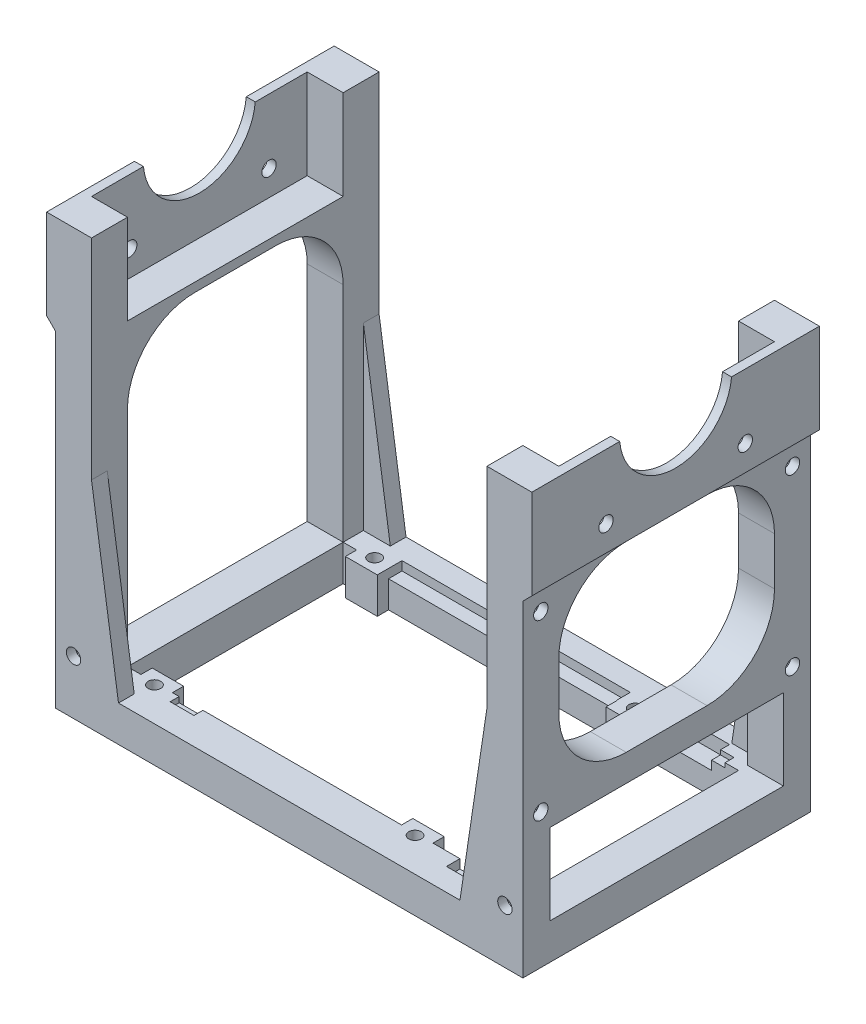
from build123d import *

# Parameters (mm, degrees)
SZKIC1_W                     = 8
SZKIC1_H                     = 48
SZKIC1_H_2                   = 8
SZKIC1_W_2                   = 92
DODANIE_WYCI_GNI_CIE1_DEPTH  = 8
SZKIC2_W                     = 8
SZKIC2_H                     = 8
DODANIE_WYCI_GNI_CIE3_DEPTH  = 64
SZKIC5_W                     = 2
SZKIC5_H                     = 18
WYTNIJ_WYCI_GNI_CIE2_DEPTH   = 8
SZKIC6_W                     = 8
SZKIC6_H                     = 6
DODANIE_WYCI_GNI_CIE5_DEPTH  = 48
SZKIC7_W                     = 50.8
SZKIC7_H                     = 3
WYTNIJ_WYCI_GNI_CIE3_DEPTH   = 2
DODANIE_WYCI_GNI_CIE7_DEPTH  = 8
DODANIE_WYCI_GNI_CIE8_DEPTH  = 8
DODANIE_WYCI_GNI_CIE9_DEPTH  = 8
DODANIE_WYCI_GNI_CIE10_DEPTH = 8
SZKIC17_W                    = 5.2
SZKIC17_H                    = 5.2
WYTNIJ_WYCI_GNI_CIE8_DEPTH   = 4
SZKIC18_R                    = 1.4
WYTNIJ_WYCI_GNI_CIE9_DEPTH   = 4.5
SZKIC19_W                    = 5.2
SZKIC19_H                    = 5.2
SZKIC19_R                    = 1.4
DODANIE_WYCI_GNI_CIE11_DEPTH = 2.3
SZKIC21_W                    = 48
SZKIC21_H                    = 8
SZKIC21_W_2                  = 8
SZKIC21_H_2                  = 64
DODANIE_WYCI_GNI_CIE12_DEPTH = 4
SZKIC22_W                    = 4
SZKIC22_H                    = 64
WYTNIJ_WYCI_GNI_CIE11_DEPTH  = 84
SZKIC24_W                    = 8
SZKIC24_H                    = 8
DODANIE_WYCI_GNI_CIE13_DEPTH = 2.64
SZKIC25_W                    = 8
SZKIC25_H                    = 2
DODANIE_WYCI_GNI_CIE14_DEPTH = 48
SZKIC26_W                    = 8
SZKIC26_H                    = 8
DODANIE_WYCI_GNI_CIE15_DEPTH = 20
SZKIC27_R                    = 1.6
DODANIE_WYCI_GNI_CIE16_DEPTH = 2
DODANIE_WYCI_GNI_CIE17_START = 2
SZKIC28_R                    = 1.6
DODANIE_WYCI_GNI_CIE17_DEPTH = 2
SFAZOWANIE1_SIZE             = 2
SZKIC29_W                    = 5.65685425
SZKIC29_H                    = 5.65685425
WYTNIJ_WYCI_GNI_CIE12_DEPTH  = 4
SZKIC29_4_R                  = 1.6
WYTNIJ_WYCI_GNI_CIE13_DEPTH  = 4.2
SZKIC29_7_R                  = 1.6
SZKIC29_7_W                  = 5.65685425
SZKIC29_7_H                  = 5.65685425
DODANIE_WYCI_GNI_CIE18_DEPTH = 2
SZKIC30_W                    = 5.65685425
SZKIC30_H                    = 5.65685425
WYTNIJ_WYCI_GNI_CIE14_DEPTH  = 4
WYTNIJ_WYCI_GNI_CIE15_START  = -4.2
SZKIC30_6_R                  = 1.6
WYTNIJ_WYCI_GNI_CIE15_DEPTH  = 4.2
DODANIE_WYCI_GNI_CIE20_START = -2
SZKIC30_8_W                  = 5.65685425
SZKIC30_8_H                  = 5.65685425
SZKIC30_8_R                  = 1.6
DODANIE_WYCI_GNI_CIE20_DEPTH = 2
SZKIC31_W                    = 5.65685425
SZKIC31_H                    = 5.65685425
SZKIC31_R                    = 1.6
WYTNIJ_WYCI_GNI_CIE16_DEPTH  = 4
SZKIC31_2_R                  = 1.6
WYTNIJ_WYCI_GNI_CIE17_DEPTH  = 4.2
SZKIC31_3_W                  = 5.65685425
SZKIC31_3_H                  = 5.65685425
SZKIC31_3_R                  = 1.6
DODANIE_WYCI_GNI_CIE21_DEPTH = 2
WYTNIJ_WYCI_GNI_CIE18_START  = -4
SZKIC32_W                    = 5.65685425
SZKIC32_H                    = 5.65685425
SZKIC32_R                    = 1.6
WYTNIJ_WYCI_GNI_CIE18_DEPTH  = 4
WYTNIJ_WYCI_GNI_CIE19_START  = -4.2
SZKIC32_2_R                  = 1.6
WYTNIJ_WYCI_GNI_CIE19_DEPTH  = 4.2
DODANIE_WYCI_GNI_CIE22_START = -2
SZKIC32_3_W                  = 5.65685425
SZKIC32_3_H                  = 5.65685425
SZKIC32_3_R                  = 1.6
DODANIE_WYCI_GNI_CIE22_DEPTH = 2
SZKIC33_W                    = 5.65685425
SZKIC33_H                    = 5.65685425
SZKIC33_R                    = 1.6
WYTNIJ_WYCI_GNI_CIE20_DEPTH  = 4
SZKIC33_2_R                  = 1.6
WYTNIJ_WYCI_GNI_CIE21_DEPTH  = 4.2
SZKIC33_3_W                  = 5.65685425
SZKIC33_3_H                  = 5.65685425
SZKIC33_3_R                  = 1.6
DODANIE_WYCI_GNI_CIE23_DEPTH = 2
DODANIE_WYCI_GNI_CIE24_DEPTH = 3.5
DODANIE_WYCI_GNI_CIE25_DEPTH = 3.5
ZAOKR_GLENIE1_R              = 15
SFAZOWANIE2_SIZE             = 4
SFAZOWANIE2_SIZE2            = 1
SZKIC38_W                    = 5.3
SZKIC38_H                    = 1.2
WYTNIJ_WYCI_GNI_CIE22_DEPTH  = 2
SZKIC39_W                    = 5
SZKIC39_H                    = 2
WYTNIJ_WYCI_GNI_CIE23_DEPTH  = 3
SZKIC40_W                    = 9
SZKIC40_H                    = 3
WYTNIJ_WYCI_GNI_CIE24_DEPTH  = 4
SZKIC41_W                    = 3
SZKIC41_H                    = 1
WYTNIJ_WYCI_GNI_CIE25_DEPTH  = 2
SZKIC42_W                    = 8
SZKIC42_H                    = 2
WYTNIJ_WYCI_GNI_CIE26_DEPTH  = 3


with BuildPart() as part:
    # Szkic1 → Dodanie-wyciągnięcie1 (new body)
    with BuildSketch(Plane(origin=(0, 0, 0), x_dir=(1, 0, 0), z_dir=(0, 1, 0))):
        with Locations((4, 32)):
            Rectangle(SZKIC1_W, SZKIC1_H)
        with Locations((4, 4)):
            Rectangle(SZKIC1_W, SZKIC1_H_2)
        with Locations((4, 60)):
            Rectangle(SZKIC1_W, SZKIC1_H_2)
        with Locations((54, 60)):
            Rectangle(SZKIC1_W_2, SZKIC1_H_2)
        with Locations((104, 60)):
            Rectangle(SZKIC1_W, SZKIC1_H_2)
        with Locations((104, 32)):
            Rectangle(SZKIC1_W, SZKIC1_H)
        with Locations((104, 4)):
            Rectangle(SZKIC1_W, SZKIC1_H_2)
        with Locations((54, 4)):
            Rectangle(SZKIC1_W_2, SZKIC1_H_2)
    extrude(amount=DODANIE_WYCI_GNI_CIE1_DEPTH)

    # Szkic2 → Dodanie-wyciągnięcie3 (add)
    with BuildSketch(Plane(origin=(0, 8, 0), x_dir=(1, 0, 0), z_dir=(0, 1, 0))):
        with Locations((4, 60)):
            Rectangle(SZKIC2_W, SZKIC2_H)
        with Locations((4, 4)):
            Rectangle(SZKIC2_W, SZKIC2_H)
        with Locations((104, 4)):
            Rectangle(SZKIC2_W, SZKIC2_H)
        with Locations((104, 60)):
            Rectangle(SZKIC2_W, SZKIC2_H)
    extrude(amount=DODANIE_WYCI_GNI_CIE3_DEPTH)

    # Szkic5 → Wytnij-wyciągnięcie2 (cut)
    with BuildSketch(Plane(origin=(108, 0, 0), x_dir=(0, 0, -1), z_dir=(1, 0, 0))):
        with Locations((7, 17)):
            Rectangle(SZKIC5_W, SZKIC5_H)
        with Locations((57, 17)):
            Rectangle(SZKIC5_W, SZKIC5_H)
    extrude(amount=-WYTNIJ_WYCI_GNI_CIE2_DEPTH, mode=Mode.SUBTRACT)

    # Szkic6 → Dodanie-wyciągnięcie5 (add)
    with BuildSketch(Plane(origin=(0, 0, -8), x_dir=(-1, 0, 0), z_dir=(0, 0, -1))):
        with Locations((-104, 29)):
            Rectangle(SZKIC6_W, SZKIC6_H)
    extrude(amount=DODANIE_WYCI_GNI_CIE5_DEPTH)

    # Szkic7 → Wytnij-wyciągnięcie3 (cut)
    with BuildSketch(Plane(origin=(0, 8, 0), x_dir=(1, 0, 0), z_dir=(0, 1, 0))):
        with Locations((47.5, 57.5)):
            Rectangle(SZKIC7_W, SZKIC7_H)
    extrude(amount=-WYTNIJ_WYCI_GNI_CIE3_DEPTH, mode=Mode.SUBTRACT)

    # Szkic12 → Dodanie-wyciągnięcie7 (add)
    with BuildSketch(Plane(origin=(0, 8, 0), x_dir=(1, 0, 0), z_dir=(0, 1, 0))):
        with BuildLine():
            Line((22.1, 56), (20.177050983, 56))
            ThreePointArc((20.177050983, 56), (18.5, 54.75), (16.822949017, 56))
            Line((16.822949017, 56), (15, 56))
            Line((15, 56), (15, 53.5))
            Line((15, 53.5), (18.5, 53.5))
            Line((18.5, 53.5), (22.1, 53.5))
            Line((22.1, 53.5), (22.1, 56))
        make_face()
        with BuildLine():
            ThreePointArc((16.822949017, 56), (18.5, 54.75), (20.177050983, 56))
            Line((20.177050983, 56), (16.822949017, 56))
        make_face()
    extrude(amount=-DODANIE_WYCI_GNI_CIE7_DEPTH)

    # Szkic14 → Dodanie-wyciągnięcie8 (add)
    with BuildSketch(Plane(origin=(0, 8, 0), x_dir=(1, 0, 0), z_dir=(0, 1, 0))):
        Polygon((18.5, 7.5), (15, 7.5), (15, 10.5), (18.5, 10.5), (22, 10.5), (22, 7.5), align=None)
    extrude(amount=-DODANIE_WYCI_GNI_CIE8_DEPTH)

    # Szkic15 → Dodanie-wyciągnięcie9 (add)
    with BuildSketch(Plane(origin=(0, 8, 0), x_dir=(1, 0, 0), z_dir=(0, 1, 0))):
        Polygon((76.5, 53.5), (73, 53.5), (73, 56.5), (76.5, 56.5), (80, 56.5), (80, 53.5), align=None)
    extrude(amount=-DODANIE_WYCI_GNI_CIE9_DEPTH)

    # Szkic16 → Dodanie-wyciągnięcie10 (add)
    with BuildSketch(Plane(origin=(0, 8, 0), x_dir=(1, 0, 0), z_dir=(0, 1, 0))):
        Polygon((76.5, 7.5), (80, 7.5), (80, 10.5), (76.5, 10.5), (73, 10.5), (73, 7.5), align=None)
    extrude(amount=-DODANIE_WYCI_GNI_CIE10_DEPTH)

    # Szkic17 → Wytnij-wyciągnięcie8 (cut)
    with BuildSketch(Plane(origin=(0, 8, 0), x_dir=(1, 0, 0), z_dir=(0, 1, 0))):
        with Locations((76.5, 7.5)):
            Rectangle(SZKIC17_W, SZKIC17_H)
        with Locations((18.5, 56.5)):
            Rectangle(SZKIC17_W, SZKIC17_H)
        with Locations((18.5, 7.5)):
            Rectangle(SZKIC17_W, SZKIC17_H)
        with Locations((76.5, 56.5)):
            Rectangle(SZKIC17_W, SZKIC17_H)
    extrude(amount=-WYTNIJ_WYCI_GNI_CIE8_DEPTH, mode=Mode.SUBTRACT)

    # Szkic18 → Wytnij-wyciągnięcie9 (cut)
    with BuildSketch(Plane(origin=(0, 8, 0), x_dir=(1, 0, 0), z_dir=(0, 1, 0))):
        with Locations(Location((18.5, 56.5, 0), (0, 0, 270))):
            Circle(SZKIC18_R)
        with Locations(Location((18.5, 7.5, 0), (0, 0, 270))):
            Circle(SZKIC18_R)
        with Locations(Location((76.5, 7.5, 0), (0, 0, 270))):
            Circle(SZKIC18_R)
        with Locations(Location((76.5, 56.5, 0), (0, 0, 270))):
            Circle(SZKIC18_R)
    extrude(amount=-WYTNIJ_WYCI_GNI_CIE9_DEPTH, mode=Mode.SUBTRACT)

    # Szkic19 → Dodanie-wyciągnięcie11 (add)
    # profile 1 of 4: a face of its own
    with BuildSketch(Plane(origin=(0, 8, 0), x_dir=(1, 0, 0), z_dir=(0, 1, 0))):
        with Locations((18.5, 56.5)):
            Rectangle(SZKIC19_W, SZKIC19_H)
        with Locations(Location((18.5, 56.5, 0), (0, 0, 270))):
            Circle(SZKIC19_R, mode=Mode.SUBTRACT)
    # profile 2 of 4: a face of its own
    with BuildSketch(Plane(origin=(0, 8, 0), x_dir=(1, 0, 0), z_dir=(0, 1, 0))):
        with Locations((18.5, 7.5)):
            Rectangle(SZKIC19_W, SZKIC19_H)
        with Locations(Location((18.5, 7.5, 0), (0, 0, 270))):
            Circle(SZKIC19_R, mode=Mode.SUBTRACT)
    # profile 3 of 4: a face of its own
    with BuildSketch(Plane(origin=(0, 8, 0), x_dir=(1, 0, 0), z_dir=(0, 1, 0))):
        with Locations((76.5, 7.5)):
            Rectangle(SZKIC19_W, SZKIC19_H)
        with Locations(Location((76.5, 7.5, 0), (0, 0, 270))):
            Circle(SZKIC19_R, mode=Mode.SUBTRACT)
    # profile 4 of 4: a face of its own
    with BuildSketch(Plane(origin=(0, 8, 0), x_dir=(1, 0, 0), z_dir=(0, 1, 0))):
        with Locations((76.5, 56.5)):
            Rectangle(SZKIC19_W, SZKIC19_H)
        with Locations(Location((76.5, 56.5, 0), (0, 0, 270))):
            Circle(SZKIC19_R, mode=Mode.SUBTRACT)
    extrude(amount=-DODANIE_WYCI_GNI_CIE11_DEPTH)

    # Szkic21 → Dodanie-wyciągnięcie12 (add)
    with BuildSketch(Plane(origin=(8, 0, 0), x_dir=(0, 0, -1), z_dir=(1, 0, 0))):
        with Locations((32, 4)):
            Rectangle(SZKIC21_W, SZKIC21_H)
        with Locations((4, 40)):
            Rectangle(SZKIC21_W_2, SZKIC21_H_2)
        with Locations((60, 40)):
            Rectangle(SZKIC21_W_2, SZKIC21_H_2)
    extrude(amount=DODANIE_WYCI_GNI_CIE12_DEPTH)

    # Szkic22 → Wytnij-wyciągnięcie11 (cut)
    with BuildSketch(Plane.XZ):
        with Locations((2, -32)):
            Rectangle(SZKIC22_W, SZKIC22_H)
    extrude(amount=-WYTNIJ_WYCI_GNI_CIE11_DEPTH, mode=Mode.SUBTRACT)

    # Szkic24 → Dodanie-wyciągnięcie13 (add)
    with BuildSketch(Plane(origin=(0, 72, 0), x_dir=(1, 0, 0), z_dir=(0, 1, 0))):
        with Locations((8, 4)):
            Rectangle(SZKIC24_W, SZKIC24_H)
        with Locations((104, 4)):
            Rectangle(SZKIC24_W, SZKIC24_H)
        with Locations((104, 60)):
            Rectangle(SZKIC24_W, SZKIC24_H)
        with Locations((8, 60)):
            Rectangle(SZKIC24_W, SZKIC24_H)
    extrude(amount=DODANIE_WYCI_GNI_CIE13_DEPTH)

    # Szkic25 → Dodanie-wyciągnięcie14 (add)
    with BuildSketch(Plane(origin=(0, 0, -8), x_dir=(-1, 0, 0), z_dir=(0, 0, -1))):
        with Locations((-104, 73.64)):
            Rectangle(SZKIC25_W, SZKIC25_H)
        with Locations((-8, 73.64)):
            Rectangle(SZKIC25_W, SZKIC25_H)
    extrude(amount=DODANIE_WYCI_GNI_CIE14_DEPTH)

    # Szkic26 → Dodanie-wyciągnięcie15 (add)
    with BuildSketch(Plane(origin=(0, 74.64, 0), x_dir=(1, 0, 0), z_dir=(0, 1, 0))):
        with Locations((8, 60)):
            Rectangle(SZKIC26_W, SZKIC26_H)
        with Locations((8, 4)):
            Rectangle(SZKIC26_W, SZKIC26_H)
        with Locations((104, 4)):
            Rectangle(SZKIC26_W, SZKIC26_H)
        with Locations((104, 60)):
            Rectangle(SZKIC26_W, SZKIC26_H)
    extrude(amount=DODANIE_WYCI_GNI_CIE15_DEPTH)

    # Szkic27 → Dodanie-wyciągnięcie16 (add)
    with BuildSketch(Plane.ZY.offset(-4)):
        with BuildLine():
            Line((-64, 94.64), (-64, 72.64))
            Line((-64, 72.64), (0, 72.64))
            Line((0, 72.64), (0, 94.64))
            Line((0, 94.64), (-19.553012413, 94.64))
            ThreePointArc((-19.553012413, 94.64), (-32, 83.29), (-44.446987587, 94.64))
            Line((-44.446987587, 94.64), (-64, 94.64))
        make_face()
        with Locations((-47.5, 80.29)):
            Circle(SZKIC27_R, mode=Mode.SUBTRACT)
        with Locations((-16.5, 80.29)):
            Circle(SZKIC27_R, mode=Mode.SUBTRACT)
    extrude(amount=DODANIE_WYCI_GNI_CIE16_DEPTH)

    # Szkic28 → Dodanie-wyciągnięcie17 (add)
    with BuildSketch(Plane(origin=(108, 0, 0), x_dir=(0, 0, -1), z_dir=(1, 0, 0)).offset(DODANIE_WYCI_GNI_CIE17_START)):
        with BuildLine():
            Line((64, 72.64), (64, 94.64))
            Line((64, 94.64), (44.446987587, 94.64))
            ThreePointArc((44.446987587, 94.64), (32, 83.29), (19.553012413, 94.64))
            Line((19.553012413, 94.64), (0, 94.64))
            Line((0, 94.64), (0, 72.64))
            Line((0, 72.64), (64, 72.64))
        make_face()
        with Locations(Location((16.5, 80.29, 0), (0, 0, 180))):
            Circle(SZKIC28_R, mode=Mode.SUBTRACT)
        with Locations(Location((47.5, 80.29, 0), (0, 0, 180))):
            Circle(SZKIC28_R, mode=Mode.SUBTRACT)
    extrude(amount=-DODANIE_WYCI_GNI_CIE17_DEPTH)

    # Sfazowanie1
    sfazowanie1_edges = [part.edges().sort_by_distance(p)[0] for p in [
        (2, 72.64, -32),
        (110, 72.64, -32),
    ]]
    chamfer(sfazowanie1_edges, length=SFAZOWANIE1_SIZE)

    # Szkic29 → Wytnij-wyciągnięcie12 (cut)
    with BuildSketch(Plane.XY):
        Polygon((5.189195685, 14.895942864), (5.154059189, 9.239197738), (10.810804315, 9.204061241), (10.845940811, 14.860806368), align=None)
        with Locations((104, 12)):
            Rectangle(SZKIC29_W, SZKIC29_H)
    extrude(amount=-WYTNIJ_WYCI_GNI_CIE12_DEPTH, mode=Mode.SUBTRACT)

    # Szkic29<4> → Wytnij-wyciągnięcie13 (cut)
    with BuildSketch(Plane.XY):
        with Locations((8, 12.050002053)):
            Circle(SZKIC29_4_R)
        with Locations((104, 12)):
            Circle(SZKIC29_4_R)
    extrude(amount=-WYTNIJ_WYCI_GNI_CIE13_DEPTH, mode=Mode.SUBTRACT)

    # Szkic29<7> → Dodanie-wyciągnięcie18 (add)
    # profile 1 of 2: a face of its own
    with BuildSketch(Plane.XY):
        Polygon((5.189195685, 14.895942864), (5.154059189, 9.239197738), (10.810804315, 9.204061241), (10.845940811, 14.860806368), align=None)
        with Locations((8, 12.050002053)):
            Circle(SZKIC29_7_R, mode=Mode.SUBTRACT)
    # profile 2 of 2: a face of its own
    with BuildSketch(Plane.XY):
        with Locations((104, 12)):
            Rectangle(SZKIC29_7_W, SZKIC29_7_H)
        with Locations((104, 12)):
            Circle(SZKIC29_7_R, mode=Mode.SUBTRACT)
    extrude(amount=-DODANIE_WYCI_GNI_CIE18_DEPTH)

    # Szkic30 → Wytnij-wyciągnięcie14 (cut)
    with BuildSketch(Plane(origin=(0, 0, -64), x_dir=(-1, 0, 0), z_dir=(0, 0, -1))):
        with Locations((-8, 12)):
            Rectangle(SZKIC30_W, SZKIC30_H)
        with Locations((-104, 12)):
            Rectangle(SZKIC30_W, SZKIC30_H)
    extrude(amount=-WYTNIJ_WYCI_GNI_CIE14_DEPTH, mode=Mode.SUBTRACT)

    # Szkic30<6> → Wytnij-wyciągnięcie15 (cut)
    with BuildSketch(Plane(origin=(0, 0, -64), x_dir=(-1, 0, 0), z_dir=(0, 0, -1)).offset(WYTNIJ_WYCI_GNI_CIE15_START)):
        with Locations(Location((-104, 12, 0), (0, 0, 180))):
            Circle(SZKIC30_6_R)
        with Locations((-8, 12)):
            Circle(SZKIC30_6_R)
    extrude(amount=WYTNIJ_WYCI_GNI_CIE15_DEPTH, mode=Mode.SUBTRACT)

    # Szkic30<8> → Dodanie-wyciągnięcie20 (add)
    # profile 1 of 2: a face of its own
    with BuildSketch(Plane(origin=(0, 0, -64), x_dir=(-1, 0, 0), z_dir=(0, 0, -1)).offset(DODANIE_WYCI_GNI_CIE20_START)):
        with Locations((-8, 12)):
            Rectangle(SZKIC30_8_W, SZKIC30_8_H)
        with Locations((-8, 12)):
            Circle(SZKIC30_8_R, mode=Mode.SUBTRACT)
    # profile 2 of 2: a face of its own
    with BuildSketch(Plane(origin=(0, 0, -64), x_dir=(-1, 0, 0), z_dir=(0, 0, -1)).offset(DODANIE_WYCI_GNI_CIE20_START)):
        with Locations((-104, 12)):
            Rectangle(SZKIC30_8_W, SZKIC30_8_H)
        with Locations(Location((-104, 12, 0), (0, 0, 180))):
            Circle(SZKIC30_8_R, mode=Mode.SUBTRACT)
    extrude(amount=DODANIE_WYCI_GNI_CIE20_DEPTH)

    # Szkic31 → Wytnij-wyciągnięcie16 (cut)
    # profile 1 of 4: a face of its own
    with BuildSketch(Plane.ZY.offset(-4)):
        with Locations((-60, 20)):
            Rectangle(SZKIC31_W, SZKIC31_H)
        with Locations((-60, 20)):
            Circle(SZKIC31_R, mode=Mode.SUBTRACT)
    # profile 2 of 4: a face of its own
    with BuildSketch(Plane.ZY.offset(-4)):
        with Locations((-4, 20)):
            Rectangle(SZKIC31_W, SZKIC31_H)
        with Locations((-4, 20)):
            Circle(SZKIC31_R, mode=Mode.SUBTRACT)
    # profile 3 of 4: a face of its own
    with BuildSketch(Plane.ZY.offset(-4)):
        with Locations((-4, 68.64)):
            Rectangle(SZKIC31_W, SZKIC31_H)
        with Locations((-4, 68.64)):
            Circle(SZKIC31_R, mode=Mode.SUBTRACT)
    # profile 4 of 4: a face of its own
    with BuildSketch(Plane.ZY.offset(-4)):
        with Locations((-60, 68.64)):
            Rectangle(SZKIC31_W, SZKIC31_H)
        with Locations((-60, 68.64)):
            Circle(SZKIC31_R, mode=Mode.SUBTRACT)
    extrude(amount=-WYTNIJ_WYCI_GNI_CIE16_DEPTH, mode=Mode.SUBTRACT)

    # Szkic31<2> → Wytnij-wyciągnięcie17 (cut)
    with BuildSketch(Plane.ZY.offset(-4)):
        with Locations((-60, 20)):
            Circle(SZKIC31_2_R)
        with Locations((-4, 20)):
            Circle(SZKIC31_2_R)
        with Locations((-4, 68.64)):
            Circle(SZKIC31_2_R)
        with Locations((-60, 68.64)):
            Circle(SZKIC31_2_R)
    extrude(amount=-WYTNIJ_WYCI_GNI_CIE17_DEPTH, mode=Mode.SUBTRACT)

    # Szkic31<3> → Dodanie-wyciągnięcie21 (add)
    # profile 1 of 4: a face of its own
    with BuildSketch(Plane.ZY.offset(-4)):
        with Locations((-60, 20)):
            Rectangle(SZKIC31_3_W, SZKIC31_3_H)
        with Locations((-60, 20)):
            Circle(SZKIC31_3_R, mode=Mode.SUBTRACT)
    # profile 2 of 4: a face of its own
    with BuildSketch(Plane.ZY.offset(-4)):
        with Locations((-4, 20)):
            Rectangle(SZKIC31_3_W, SZKIC31_3_H)
        with Locations((-4, 20)):
            Circle(SZKIC31_3_R, mode=Mode.SUBTRACT)
    # profile 3 of 4: a face of its own
    with BuildSketch(Plane.ZY.offset(-4)):
        with Locations((-4, 68.64)):
            Rectangle(SZKIC31_3_W, SZKIC31_3_H)
        with Locations((-4, 68.64)):
            Circle(SZKIC31_3_R, mode=Mode.SUBTRACT)
    # profile 4 of 4: a face of its own
    with BuildSketch(Plane.ZY.offset(-4)):
        with Locations((-60, 68.64)):
            Rectangle(SZKIC31_3_W, SZKIC31_3_H)
        with Locations((-60, 68.64)):
            Circle(SZKIC31_3_R, mode=Mode.SUBTRACT)
    extrude(amount=-DODANIE_WYCI_GNI_CIE21_DEPTH)

    # Szkic32 → Wytnij-wyciągnięcie18 (cut)
    # profile 1 of 4: a face of its own
    with BuildSketch(Plane(origin=(108, 0, 0), x_dir=(0, 0, -1), z_dir=(1, 0, 0)).offset(WYTNIJ_WYCI_GNI_CIE18_START)):
        with Locations((60, 68.64)):
            Rectangle(SZKIC32_W, SZKIC32_H)
        with Locations(Location((60, 68.64, 0), (0, 0, 180))):
            Circle(SZKIC32_R, mode=Mode.SUBTRACT)
    # profile 2 of 4: a face of its own
    with BuildSketch(Plane(origin=(108, 0, 0), x_dir=(0, 0, -1), z_dir=(1, 0, 0)).offset(WYTNIJ_WYCI_GNI_CIE18_START)):
        with Locations((4, 68.64)):
            Rectangle(SZKIC32_W, SZKIC32_H)
        with Locations(Location((4, 68.64, 0), (0, 0, 180))):
            Circle(SZKIC32_R, mode=Mode.SUBTRACT)
    # profile 3 of 4: a face of its own
    with BuildSketch(Plane(origin=(108, 0, 0), x_dir=(0, 0, -1), z_dir=(1, 0, 0)).offset(WYTNIJ_WYCI_GNI_CIE18_START)):
        with Locations((60, 30)):
            Rectangle(SZKIC32_W, SZKIC32_H)
        with Locations((60, 30)):
            Circle(SZKIC32_R, mode=Mode.SUBTRACT)
    # profile 4 of 4: a face of its own
    with BuildSketch(Plane(origin=(108, 0, 0), x_dir=(0, 0, -1), z_dir=(1, 0, 0)).offset(WYTNIJ_WYCI_GNI_CIE18_START)):
        with Locations((4, 30)):
            Rectangle(SZKIC32_W, SZKIC32_H)
        with Locations((4, 30)):
            Circle(SZKIC32_R, mode=Mode.SUBTRACT)
    extrude(amount=WYTNIJ_WYCI_GNI_CIE18_DEPTH, mode=Mode.SUBTRACT)

    # Szkic32<2> → Wytnij-wyciągnięcie19 (cut)
    with BuildSketch(Plane(origin=(108, 0, 0), x_dir=(0, 0, -1), z_dir=(1, 0, 0)).offset(WYTNIJ_WYCI_GNI_CIE19_START)):
        with Locations(Location((4, 68.64, 0), (0, 0, 180))):
            Circle(SZKIC32_2_R)
        with Locations(Location((60, 68.64, 0), (0, 0, 180))):
            Circle(SZKIC32_2_R)
        with Locations((60, 30)):
            Circle(SZKIC32_2_R)
        with Locations((4, 30)):
            Circle(SZKIC32_2_R)
    extrude(amount=WYTNIJ_WYCI_GNI_CIE19_DEPTH, mode=Mode.SUBTRACT)

    # Szkic32<3> → Dodanie-wyciągnięcie22 (add)
    # profile 1 of 4: a face of its own
    with BuildSketch(Plane(origin=(108, 0, 0), x_dir=(0, 0, -1), z_dir=(1, 0, 0)).offset(DODANIE_WYCI_GNI_CIE22_START)):
        with Locations((60, 68.64)):
            Rectangle(SZKIC32_3_W, SZKIC32_3_H)
        with Locations(Location((60, 68.64, 0), (0, 0, 180))):
            Circle(SZKIC32_3_R, mode=Mode.SUBTRACT)
    # profile 2 of 4: a face of its own
    with BuildSketch(Plane(origin=(108, 0, 0), x_dir=(0, 0, -1), z_dir=(1, 0, 0)).offset(DODANIE_WYCI_GNI_CIE22_START)):
        with Locations((4, 68.64)):
            Rectangle(SZKIC32_3_W, SZKIC32_3_H)
        with Locations(Location((4, 68.64, 0), (0, 0, 180))):
            Circle(SZKIC32_3_R, mode=Mode.SUBTRACT)
    # profile 3 of 4: a face of its own
    with BuildSketch(Plane(origin=(108, 0, 0), x_dir=(0, 0, -1), z_dir=(1, 0, 0)).offset(DODANIE_WYCI_GNI_CIE22_START)):
        with Locations((60, 30)):
            Rectangle(SZKIC32_3_W, SZKIC32_3_H)
        with Locations((60, 30)):
            Circle(SZKIC32_3_R, mode=Mode.SUBTRACT)
    # profile 4 of 4: a face of its own
    with BuildSketch(Plane(origin=(108, 0, 0), x_dir=(0, 0, -1), z_dir=(1, 0, 0)).offset(DODANIE_WYCI_GNI_CIE22_START)):
        with Locations((4, 30)):
            Rectangle(SZKIC32_3_W, SZKIC32_3_H)
        with Locations((4, 30)):
            Circle(SZKIC32_3_R, mode=Mode.SUBTRACT)
    extrude(amount=DODANIE_WYCI_GNI_CIE22_DEPTH)

    # Szkic33 → Wytnij-wyciągnięcie20 (cut)
    # profile 1 of 4: a face of its own
    with BuildSketch(Plane.XZ):
        with Locations((8, -60)):
            Rectangle(SZKIC33_W, SZKIC33_H)
        with Locations(Location((8, -60, 0), (0, 0, 270))):
            Circle(SZKIC33_R, mode=Mode.SUBTRACT)
    # profile 2 of 4: a face of its own
    with BuildSketch(Plane.XZ):
        with Locations((104, -60)):
            Rectangle(SZKIC33_W, SZKIC33_H)
        with Locations(Location((104, -60, 0), (0, 0, 270))):
            Circle(SZKIC33_R, mode=Mode.SUBTRACT)
    # profile 3 of 4: a face of its own
    with BuildSketch(Plane.XZ):
        with Locations((104, -4)):
            Rectangle(SZKIC33_W, SZKIC33_H)
        with Locations(Location((104, -4, 0), (0, 0, 270))):
            Circle(SZKIC33_R, mode=Mode.SUBTRACT)
    # profile 4 of 4: a face of its own
    with BuildSketch(Plane.XZ):
        with Locations((8, -4)):
            Rectangle(SZKIC33_W, SZKIC33_H)
        with Locations(Location((8, -4, 0), (0, 0, 270))):
            Circle(SZKIC33_R, mode=Mode.SUBTRACT)
    extrude(amount=-WYTNIJ_WYCI_GNI_CIE20_DEPTH, mode=Mode.SUBTRACT)

    # Szkic33<2> → Wytnij-wyciągnięcie21 (cut)
    with BuildSketch(Plane.XZ):
        with Locations(Location((8, -4, 0), (0, 0, 270))):
            Circle(SZKIC33_2_R)
        with Locations(Location((104, -4, 0), (0, 0, 270))):
            Circle(SZKIC33_2_R)
        with Locations(Location((104, -60, 0), (0, 0, 270))):
            Circle(SZKIC33_2_R)
        with Locations(Location((8, -60, 0), (0, 0, 270))):
            Circle(SZKIC33_2_R)
    extrude(amount=-WYTNIJ_WYCI_GNI_CIE21_DEPTH, mode=Mode.SUBTRACT)

    # Szkic33<3> → Dodanie-wyciągnięcie23 (add)
    # profile 1 of 4: a face of its own
    with BuildSketch(Plane.XZ):
        with Locations((8, -60)):
            Rectangle(SZKIC33_3_W, SZKIC33_3_H)
        with Locations(Location((8, -60, 0), (0, 0, 270))):
            Circle(SZKIC33_3_R, mode=Mode.SUBTRACT)
    # profile 2 of 4: a face of its own
    with BuildSketch(Plane.XZ):
        with Locations((104, -60)):
            Rectangle(SZKIC33_3_W, SZKIC33_3_H)
        with Locations(Location((104, -60, 0), (0, 0, 270))):
            Circle(SZKIC33_3_R, mode=Mode.SUBTRACT)
    # profile 3 of 4: a face of its own
    with BuildSketch(Plane.XZ):
        with Locations((104, -4)):
            Rectangle(SZKIC33_3_W, SZKIC33_3_H)
        with Locations(Location((104, -4, 0), (0, 0, 270))):
            Circle(SZKIC33_3_R, mode=Mode.SUBTRACT)
    # profile 4 of 4: a face of its own
    with BuildSketch(Plane.XZ):
        with Locations((8, -4)):
            Rectangle(SZKIC33_3_W, SZKIC33_3_H)
        with Locations(Location((8, -4, 0), (0, 0, 270))):
            Circle(SZKIC33_3_R, mode=Mode.SUBTRACT)
    extrude(amount=-DODANIE_WYCI_GNI_CIE23_DEPTH)

    # Szkic36 → Dodanie-wyciągnięcie24 (add)
    with BuildSketch(Plane.XY):
        Polygon((12, 8), (18, 8), (12, 48), align=None)
        Polygon((100, 8), (94, 8), (100, 48), align=None)
    extrude(amount=-DODANIE_WYCI_GNI_CIE24_DEPTH)

    # Szkic37 → Dodanie-wyciągnięcie25 (add)
    with BuildSketch(Plane(origin=(0, 0, -64), x_dir=(-1, 0, 0), z_dir=(0, 0, -1))):
        Polygon((-12, 8), (-18, 8), (-12, 48), align=None)
        Polygon((-100, 8), (-94, 8), (-100, 48), align=None)
    extrude(amount=-DODANIE_WYCI_GNI_CIE25_DEPTH)

    # Zaokrąglenie1
    # the kernel refuses this fillet: 15 mm, written as the material it adds along each edge
    with BuildSketch(Plane(origin=(100, 32, -8), x_dir=(0, 1, 0), z_dir=(1, 0, 0)), Plane(origin=(100, 32, -56), x_dir=(0, 0, 1), z_dir=(1, 0, 0))) as zaokr_glenie1_piece_1:
        with BuildLine():
            CenterArc((ZAOKR_GLENIE1_R, -ZAOKR_GLENIE1_R), ZAOKR_GLENIE1_R, 90, 90)
            Line((0, -ZAOKR_GLENIE1_R), (0, 0))
            Line((0, 0), (ZAOKR_GLENIE1_R, 0))
        make_face()
    extrude(amount=8)
    with BuildSketch(Plane(origin=(100, 72.64, -8), x_dir=(0, -1, 0), z_dir=(1, 0, 0))) as zaokr_glenie1_piece_2_section:
        with BuildLine():
            CenterArc((ZAOKR_GLENIE1_R, ZAOKR_GLENIE1_R), ZAOKR_GLENIE1_R, 180, 90)
            Line((0, ZAOKR_GLENIE1_R), (0, 0))
            Line((0, 0), (ZAOKR_GLENIE1_R, 0))
        make_face()
    zaokr_glenie1_piece_2 = extrude(amount=8, mode=Mode.PRIVATE)
    zaokr_glenie1_piece_2 = split(zaokr_glenie1_piece_2, bisect_by=Plane(origin=(104.741943428, 69.381943428, -12.493765783), z_dir=(-0.7071067811865476, 0.7071067811865476, 0)), keep=Keep.TOP, mode=Mode.PRIVATE)
    add(zaokr_glenie1_piece_2)
    with BuildSketch(Plane(origin=(100, 72.64, -8), x_dir=(0, -1, 0), z_dir=(1, 0, 0))) as zaokr_glenie1_piece_3_section:
        with BuildLine():
            CenterArc((ZAOKR_GLENIE1_R, ZAOKR_GLENIE1_R), ZAOKR_GLENIE1_R, 180, 90)
            Line((0, ZAOKR_GLENIE1_R), (0, 0))
            Line((0, 0), (ZAOKR_GLENIE1_R, 0))
        make_face()
    zaokr_glenie1_piece_3 = extrude(amount=8, mode=Mode.PRIVATE)
    zaokr_glenie1_piece_3 = split(zaokr_glenie1_piece_3, bisect_by=Plane(origin=(103.628568103, 68.268568103, -9.715206844), z_dir=(0.7071067811865476, -0.7071067811865476, 0)), keep=Keep.TOP, mode=Mode.PRIVATE)
    add(zaokr_glenie1_piece_3)
    with BuildSketch(Plane(origin=(100, 72.64, -56), x_dir=(0, 0, 1), z_dir=(1, 0, 0))) as zaokr_glenie1_piece_4_section:
        with BuildLine():
            CenterArc((ZAOKR_GLENIE1_R, ZAOKR_GLENIE1_R), ZAOKR_GLENIE1_R, 180, 90)
            Line((0, ZAOKR_GLENIE1_R), (0, 0))
            Line((0, 0), (ZAOKR_GLENIE1_R, 0))
        make_face()
    zaokr_glenie1_piece_4 = extrude(amount=8, mode=Mode.PRIVATE)
    zaokr_glenie1_piece_4 = split(zaokr_glenie1_piece_4, bisect_by=Plane(origin=(104.741943428, 69.381943428, -51.506234217), z_dir=(-0.7071067811865476, 0.7071067811865476, 0)), keep=Keep.TOP, mode=Mode.PRIVATE)
    add(zaokr_glenie1_piece_4)
    with BuildSketch(Plane(origin=(100, 72.64, -56), x_dir=(0, 0, 1), z_dir=(1, 0, 0))) as zaokr_glenie1_piece_5_section:
        with BuildLine():
            CenterArc((ZAOKR_GLENIE1_R, ZAOKR_GLENIE1_R), ZAOKR_GLENIE1_R, 180, 90)
            Line((0, ZAOKR_GLENIE1_R), (0, 0))
            Line((0, 0), (ZAOKR_GLENIE1_R, 0))
        make_face()
    zaokr_glenie1_piece_5 = extrude(amount=8, mode=Mode.PRIVATE)
    zaokr_glenie1_piece_5 = split(zaokr_glenie1_piece_5, bisect_by=Plane(origin=(103.628568105, 68.268568105, -54.284793163), z_dir=(0.7071067811865476, -0.7071067811865476, 0)), keep=Keep.TOP, mode=Mode.PRIVATE)
    add(zaokr_glenie1_piece_5)
    with BuildSketch(Plane(origin=(4, 72.64, -8), x_dir=(0, -1, 0), z_dir=(1, 0, 0))) as zaokr_glenie1_piece_6_section:
        with BuildLine():
            CenterArc((ZAOKR_GLENIE1_R, ZAOKR_GLENIE1_R), ZAOKR_GLENIE1_R, 180, 90)
            Line((0, ZAOKR_GLENIE1_R), (0, 0))
            Line((0, 0), (ZAOKR_GLENIE1_R, 0))
        make_face()
    zaokr_glenie1_piece_6 = extrude(amount=8, mode=Mode.PRIVATE)
    zaokr_glenie1_piece_6 = split(zaokr_glenie1_piece_6, bisect_by=Plane(origin=(8.371431897, 68.268568103, -9.715206844), z_dir=(-0.7071067811865476, -0.7071067811865476, 0)), keep=Keep.TOP, mode=Mode.PRIVATE)
    add(zaokr_glenie1_piece_6)
    with BuildSketch(Plane(origin=(4, 72.64, -8), x_dir=(0, -1, 0), z_dir=(1, 0, 0))) as zaokr_glenie1_piece_7_section:
        with BuildLine():
            CenterArc((ZAOKR_GLENIE1_R, ZAOKR_GLENIE1_R), ZAOKR_GLENIE1_R, 180, 90)
            Line((0, ZAOKR_GLENIE1_R), (0, 0))
            Line((0, 0), (ZAOKR_GLENIE1_R, 0))
        make_face()
    zaokr_glenie1_piece_7 = extrude(amount=8, mode=Mode.PRIVATE)
    zaokr_glenie1_piece_7 = split(zaokr_glenie1_piece_7, bisect_by=Plane(origin=(7.258056572, 69.381943428, -12.493765783), z_dir=(0.7071067811865476, 0.7071067811865476, 0)), keep=Keep.TOP, mode=Mode.PRIVATE)
    add(zaokr_glenie1_piece_7)
    with BuildSketch(Plane(origin=(4, 72.64, -56), x_dir=(0, -1, 0), z_dir=(1, 0, 0))) as zaokr_glenie1_piece_8_section:
        with BuildLine():
            CenterArc((ZAOKR_GLENIE1_R, -ZAOKR_GLENIE1_R), ZAOKR_GLENIE1_R, 90, 90)
            Line((0, -ZAOKR_GLENIE1_R), (0, 0))
            Line((0, 0), (ZAOKR_GLENIE1_R, 0))
        make_face()
    zaokr_glenie1_piece_8 = extrude(amount=8, mode=Mode.PRIVATE)
    zaokr_glenie1_piece_8 = split(zaokr_glenie1_piece_8, bisect_by=Plane(origin=(8.371431897, 68.268568103, -54.284793156), z_dir=(-0.7071067811865476, -0.7071067811865476, 0)), keep=Keep.TOP, mode=Mode.PRIVATE)
    add(zaokr_glenie1_piece_8)
    with BuildSketch(Plane(origin=(4, 72.64, -56), x_dir=(0, -1, 0), z_dir=(1, 0, 0))) as zaokr_glenie1_piece_9_section:
        with BuildLine():
            CenterArc((ZAOKR_GLENIE1_R, -ZAOKR_GLENIE1_R), ZAOKR_GLENIE1_R, 90, 90)
            Line((0, -ZAOKR_GLENIE1_R), (0, 0))
            Line((0, 0), (ZAOKR_GLENIE1_R, 0))
        make_face()
    zaokr_glenie1_piece_9 = extrude(amount=8, mode=Mode.PRIVATE)
    zaokr_glenie1_piece_9 = split(zaokr_glenie1_piece_9, bisect_by=Plane(origin=(7.258056572, 69.381943428, -51.506234217), z_dir=(0.7071067811865476, 0.7071067811865476, 0)), keep=Keep.TOP, mode=Mode.PRIVATE)
    add(zaokr_glenie1_piece_9)

    # Sfazowanie2
    sfazowanie2_edges = [part.edges().sort_by_distance(p)[0] for p in [
        (100, 26, -32),
    ]]
    sfazowanie2_side = [part.faces().sort_by_distance(p)[0] for p in [
        (104, 26, -32),
    ]]
    chamfer(sfazowanie2_edges, length=SFAZOWANIE2_SIZE, length2=SFAZOWANIE2_SIZE2, reference=sfazowanie2_side[0])

    # Szkic38 → Wytnij-wyciągnięcie22 (cut)
    with BuildSketch(Plane(origin=(0, 0, -8), x_dir=(-1, 0, 0), z_dir=(0, 0, -1))):
        with Locations((-26.15, 7.4)):
            Rectangle(SZKIC38_W, SZKIC38_H)
    extrude(amount=-WYTNIJ_WYCI_GNI_CIE22_DEPTH, mode=Mode.SUBTRACT)

    # Szkic39 → Wytnij-wyciągnięcie23 (cut)
    with BuildSketch(Plane.XY.offset(-56)):
        with Locations((82.5, 7)):
            Rectangle(SZKIC39_W, SZKIC39_H)
    extrude(amount=-WYTNIJ_WYCI_GNI_CIE23_DEPTH, mode=Mode.SUBTRACT)

    # Szkic40 → Wytnij-wyciągnięcie24 (cut)
    with BuildSketch(Plane.XY.offset(-56)):
        with Locations((89.5, 6.5)):
            Rectangle(SZKIC40_W, SZKIC40_H)
    extrude(amount=-WYTNIJ_WYCI_GNI_CIE24_DEPTH, mode=Mode.SUBTRACT)

    # Szkic41 → Wytnij-wyciągnięcie25 (cut)
    with BuildSketch(Plane.XY.offset(-56)):
        with Locations((95.5, 7.5)):
            Rectangle(SZKIC41_W, SZKIC41_H)
    extrude(amount=-WYTNIJ_WYCI_GNI_CIE25_DEPTH, mode=Mode.SUBTRACT)

    # Szkic42 → Wytnij-wyciągnięcie26 (cut)
    with BuildSketch(Plane(origin=(0, 0, -8), x_dir=(-1, 0, 0), z_dir=(0, 0, -1))):
        with Locations((-89.997570444, 7)):
            Rectangle(SZKIC42_W, SZKIC42_H)
    extrude(amount=-WYTNIJ_WYCI_GNI_CIE26_DEPTH, mode=Mode.SUBTRACT)


solid = part.part
